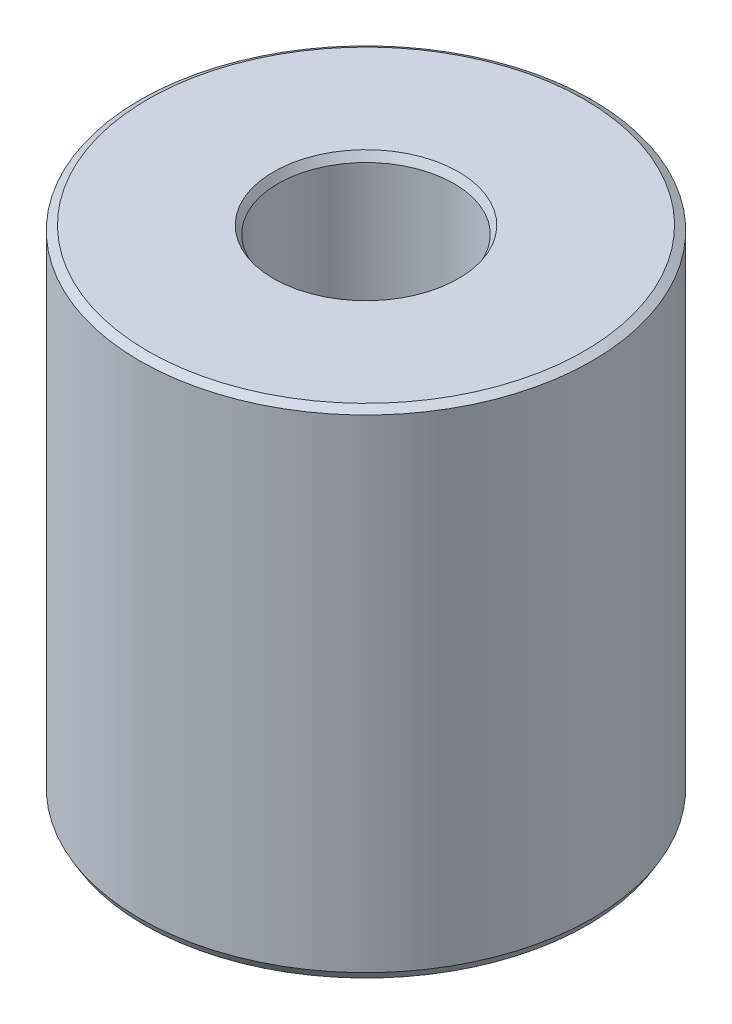
from build123d import *
from OCP.BRepFilletAPI import BRepFilletAPI_MakeChamfer

# Parameters (mm, degrees)
SKETCH1_R           = 40
BOSS_EXTRUDE1_DEPTH = 87.64639642
SKETCH2_R           = 15.56359406
CUT_EXTRUDE1_DEPTH  = 105.316301724
CHAMFER1_SIZE       = 0.805987374
CHAMFER1_SIZE2      = 1.396011082


with BuildPart() as part:
    # Sketch1 → Boss-Extrude1 (new body)
    with BuildSketch(Plane(origin=(0, 0, 0), x_dir=(1, 0, 0), z_dir=(0, 1, 0))):
        Circle(SKETCH1_R)
    extrude(amount=BOSS_EXTRUDE1_DEPTH)

    # Sketch2 → Cut-Extrude1 (cut, through all)
    with BuildSketch(Plane(origin=(0, 0, 0), x_dir=(1, 0, 0), z_dir=(0, 1, 0))):
        Circle(SKETCH2_R)
    extrude(amount=CUT_EXTRUDE1_DEPTH, mode=Mode.SUBTRACT)

    # Chamfer1: one chamfer whose edges measure the first distance from different faces: ONE call of the kernel's chamfer builder (chamfer() names one face for all edges)
    chamfer1_edges_1 = [part.edges().sort_by_distance(p)[0] for p in [
        (-15.56359406, 87.64639642, 0),
    ]]
    chamfer1_side_1 = [part.faces().sort_by_distance(p)[0] for p in [
        (-38.86862915, 87.64639642, 0),
    ]]
    chamfer1_edges_2 = [part.edges().sort_by_distance(p)[0] for p in [
        (-15.56359406, 0, 0),
    ]]
    chamfer1_side_2 = [part.faces().sort_by_distance(p)[0] for p in [
        (-15.56359406, 43.82319821, 0),
    ]]
    chamfer1_edges_3 = [part.edges().sort_by_distance(p)[0] for p in [
        (-40, 0, 0),
    ]]
    chamfer1_side_3 = [part.faces().sort_by_distance(p)[0] for p in [
        (-38.86862915, 0, 0),
    ]]
    chamfer1_edges_4 = [part.edges().sort_by_distance(p)[0] for p in [
        (-40, 87.64639642, 0),
    ]]
    chamfer1_side_4 = [part.faces().sort_by_distance(p)[0] for p in [
        (-40, 43.82319821, 0),
    ]]
    chamfer1 = BRepFilletAPI_MakeChamfer(part.part.solid().wrapped)
    for e in chamfer1_edges_1:
        chamfer1.Add(CHAMFER1_SIZE, CHAMFER1_SIZE2, e.wrapped, chamfer1_side_1[0].wrapped)  # the first distance lies on this face
    for e in chamfer1_edges_2:
        chamfer1.Add(CHAMFER1_SIZE, CHAMFER1_SIZE2, e.wrapped, chamfer1_side_2[0].wrapped)  # the first distance lies on this face
    for e in chamfer1_edges_3:
        chamfer1.Add(CHAMFER1_SIZE, CHAMFER1_SIZE2, e.wrapped, chamfer1_side_3[0].wrapped)  # the first distance lies on this face
    for e in chamfer1_edges_4:
        chamfer1.Add(CHAMFER1_SIZE, CHAMFER1_SIZE2, e.wrapped, chamfer1_side_4[0].wrapped)  # the first distance lies on this face
    add(Compound.cast(chamfer1.Shape()), mode=Mode.REPLACE)


solid = part.part
